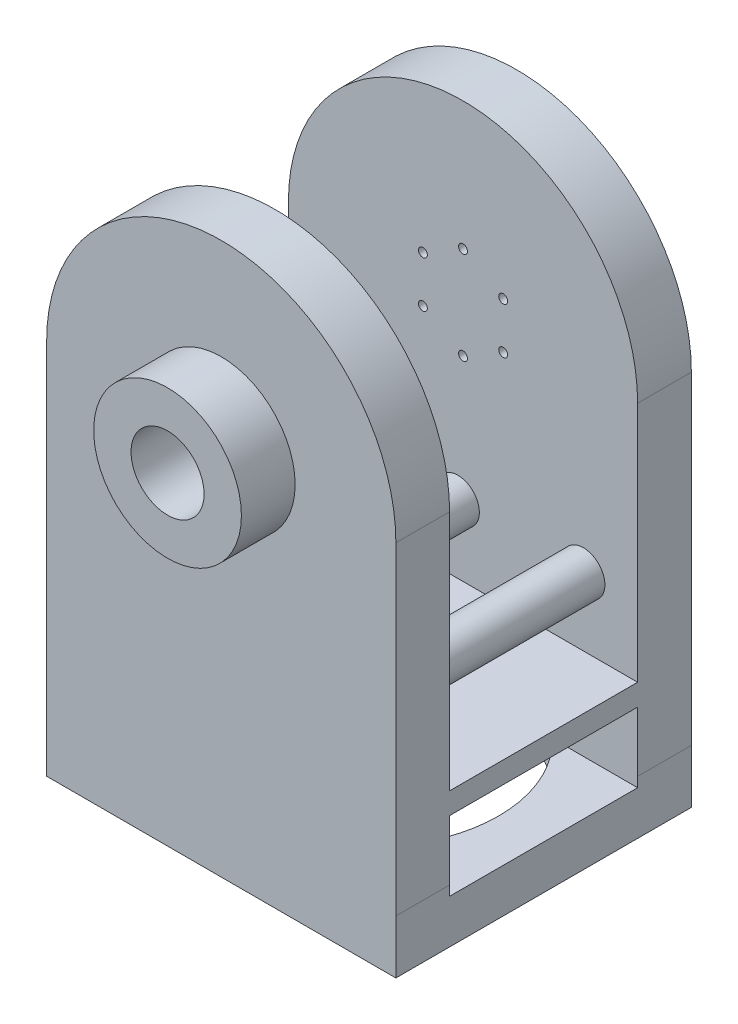
from build123d import *

# Parameters (mm, degrees)
SKETCH_1_R                      = 48.25
EXTRUDE_1_DEPTH                 = 20
SKETCH_2_R                      = 8
EXTRUDE_2_DEPTH                 = 70
EXTRUDE_START                   = 20
SKETCH_3_R                      = 48.25
EXTRUDE_3_DEPTH                 = 20
EXTRUDE_4_DEPTH                 = 149
EXTRUDE_START_2                 = -120.265870341
EXTRUDE_4_2_OUTLINE_W           = 1.999969756
EXTRUDE_4_2_OUTLINE_H           = 20
EXTRUDE_4_2_DEPTH               = 140.265870341
EXTRUDE_4_3_OUTLINE_W           = 130.000007332
EXTRUDE_4_3_OUTLINE_H           = 20
EXTRUDE_4_3_DEPTH               = 20
EXTRUDE_6_DEPTH                 = 70
CUT_EXTRUDE_3_DEPTH             = 20
EXTRUDE_START_3                 = -20
SKETCH_8_R                      = 48.25
EXTRUDE_7_DEPTH                 = 20
SKETCH_9_R                      = 48.25
EXTRUDE_8_DEPTH                 = 20
SKETCH_10_R                     = 1.65
EXTRUDE_9_DEPTH                 = 10
EXTRUDE_START_4                 = 10
SKETCH_11_R                     = 1.65
EXTRUDE_10_DEPTH                = 10
SKETCH_14_R                     = 27.5
SKETCH_14_R_2                   = 13.594481218
EXTRUDE_12_DEPTH                = 20
CUT_EXTRUDE_4_REACH             = 237.432
SKETCH_15_R                     = 1.65
CUT_EXTRUDE_4_DIRECTION_2_DEPTH = 236.431704876
EXTRUDE_13_REACH                = 227.007
SKETCH_16_W                     = 130
SKETCH_16_H                     = 8
CUT_EXTRUDE_START               = 70
SKETCH_17_R                     = 8
CUT_EXTRUDE_5_DEPTH             = 70
SKETCH_18_R                     = 1.5
EXTRUDE_14_DEPTH                = 14
CHAMFER_1_SIZE                  = 4


with BuildPart() as part:
    # 草图1 → 凸台-拉伸1 (new body)
    with BuildSketch(Plane.XY):
        with BuildLine():
            Line((-65, -103.52590801), (-65, 120.208570031))
            ThreePointArc((-65, 120.208570031), (0, 185.208570031), (65, 120.208570031))
            Line((65, 120.208570031), (65, -103.52590801))
            ThreePointArc((65, -103.52590801), (0, -168.52590801), (-65, -103.52590801))
        make_face()
        with Locations((0, 120.208570031)):
            Circle(SKETCH_1_R, mode=Mode.SUBTRACT)
        with Locations(Location((0, -103.52590801, 0), (0, 0, 180))):
            Circle(SKETCH_1_R, mode=Mode.SUBTRACT)
    extrude(amount=EXTRUDE_1_DEPTH)

    # 草图2 → 凸台-拉伸2 (add)
    with BuildSketch(Plane(origin=(0, 0, 0), x_dir=(-1, 0, 0), z_dir=(0, 0, -1))):
        with Locations(Location((-44.812568829, 55.531490167, 0), (0, 0, 180))):
            Circle(SKETCH_2_R)
        with Locations(Location((-44.812568829, -39.65707978, 0), (0, 0, 180))):
            Circle(SKETCH_2_R)
        with Locations(Location((48.660082913, -39.65707978, 0), (0, 0, 180))):
            Circle(SKETCH_2_R)
        with Locations(Location((48.660082913, 55.531490167, 0), (0, 0, 180))):
            Circle(SKETCH_2_R)
        with Locations(Location((1.923757042, 55.531490167, 0), (0, 0, 180))):
            Circle(SKETCH_2_R)
        with Locations(Location((1.923757042, -39.65707978, 0), (0, 0, 180))):
            Circle(SKETCH_2_R)
        with Locations(Location((-44.812568829, 7.937205194, 0), (0, 0, 180))):
            Circle(SKETCH_2_R)
        with Locations(Location((48.660082913, 7.937205194, 0), (0, 0, 180))):
            Circle(SKETCH_2_R)
    extrude(amount=EXTRUDE_2_DEPTH)

    # 草图3 → 凸台-拉伸3 (add)
    with BuildSketch(Plane(origin=(0, 0, -70), x_dir=(-1, 0, 0), z_dir=(0, 0, -1)).offset(EXTRUDE_START)):
        with BuildLine():
            Line((65, -103.52590801), (65, 120.208570031))
            ThreePointArc((65, 120.208570031), (0, 185.208570031), (-65, 120.208570031))
            Line((-65, 120.208570031), (-65, -103.52590801))
            ThreePointArc((-65, -103.52590801), (0, -168.52590801), (65, -103.52590801))
        make_face()
        with Locations(Location((0, 120.208570031, 0), (0, 0, 180))):
            Circle(SKETCH_3_R, mode=Mode.SUBTRACT)
        with Locations((0, -103.52590801)):
            Circle(SKETCH_3_R, mode=Mode.SUBTRACT)
    extrude(amount=-EXTRUDE_3_DEPTH)

    # 凸台-拉伸4: read off the stored shape, not the designer's step
    # 凸台-拉伸4 outline → 凸台-拉伸4 (cut)
    with BuildSketch(Plane(origin=(-2.6578e-05, -0.079137147, 0), x_dir=(0.9999999436033571, -0.0003358471121103656, 0), z_dir=(-0.0003358471121103656, -0.9999999436033572, 0)).offset(EXTRUDE_START)):
        Polygon((-64.999977088, 20), (-64.999977088, -90), (67, -90), (67, -70), (65.000030244, -70), (65.000030244, 0), (67, 0), (67, 20), align=None)
    extrude(amount=EXTRUDE_4_DEPTH, mode=Mode.SUBTRACT)

    # Extrude 4 2 outline → Extrude 4 2 (cut)
    with BuildSketch(Plane(origin=(-2.6578e-05, -0.079137147, 0), x_dir=(0.9999999436033571, -0.0003358471121103656, 0), z_dir=(-0.0003358471121103656, -0.9999999436033572, 0)).offset(EXTRUDE_START_2)):
        with Locations((66.000015122, 10)):
            Rectangle(EXTRUDE_4_2_OUTLINE_W, EXTRUDE_4_2_OUTLINE_H)
        with Locations((66.000015122, -80)):
            Rectangle(EXTRUDE_4_2_OUTLINE_W, EXTRUDE_4_2_OUTLINE_H)
    extrude(amount=EXTRUDE_4_2_DEPTH, mode=Mode.SUBTRACT)

    # Extrude 4 3 outline → Extrude 4 3 (add)
    with BuildSketch(Plane(origin=(-2.6578e-05, -0.079137147, 0), x_dir=(0.9999999436033571, -0.0003358471121103656, 0), z_dir=(-0.0003358471121103656, -0.9999999436033572, 0))):
        with Locations((2.6578e-05, 10)):
            Rectangle(EXTRUDE_4_3_OUTLINE_W, EXTRUDE_4_3_OUTLINE_H)
        with Locations((2.6578e-05, -80)):
            Rectangle(EXTRUDE_4_3_OUTLINE_W, EXTRUDE_4_3_OUTLINE_H)
    extrude(amount=EXTRUDE_4_3_DEPTH)

    # 草图6 → 凸台-拉伸6 (add)
    with BuildSketch(Plane.XY.offset(-70)):
        Polygon((64.998772091, -3.757122016), (-65.001227909, -3.713461889), (-65.006716942, -20.057305964), (64.993283058, -20.100966091), align=None)
    extrude(amount=EXTRUDE_6_DEPTH)

    # 草图7 → 切除-拉伸3 (cut)
    with BuildSketch(Plane(origin=(-0.00674352, -20.079136019, 0), x_dir=(0.9999999436033571, -0.00033584711211036565, 0), z_dir=(-0.00033584711211036565, -0.9999999436033572, 0))):
        with BuildLine():
            ThreePointArc((2.6578e-05, 13.25), (-34.117875614, -0.882097808), (-48.249973422, -35))
            Line((-48.249973422, -35), (2.6578e-05, -35))
            Line((2.6578e-05, -35), (2.6578e-05, 13.25))
        make_face()
        with BuildLine():
            Line((2.6578e-05, -35), (-48.249973422, -35))
            ThreePointArc((-48.249973422, -35), (-34.117875614, -69.117902192), (2.6578e-05, -83.25))
            Line((2.6578e-05, -83.25), (2.6578e-05, -35))
        make_face()
        with BuildLine():
            Line((2.6578e-05, 13.25), (2.6578e-05, -35))
            Line((2.6578e-05, -35), (48.250026578, -35))
            ThreePointArc((48.250026578, -35), (34.11792877, -0.882097808), (2.6578e-05, 13.25))
        make_face()
        with BuildLine():
            Line((48.250026578, -35), (2.6578e-05, -35))
            Line((2.6578e-05, -35), (2.6578e-05, -83.25))
            ThreePointArc((2.6578e-05, -83.25), (34.11792877, -69.117902192), (48.250026578, -35))
        make_face()
    extrude(amount=-CUT_EXTRUDE_3_DEPTH, mode=Mode.SUBTRACT)

    # 草图8 → 凸台-拉伸7 (add)
    with BuildSketch(Plane.XY.offset(20).offset(EXTRUDE_START_3)):
        with Locations(Location((0, 120.208570031, 0), (0, 0, 180))):
            Circle(SKETCH_8_R)
    extrude(amount=EXTRUDE_7_DEPTH)

    # 草图9 → 凸台-拉伸8 (add)
    with BuildSketch(Plane(origin=(0, 0, -90), x_dir=(-1, 0, 0), z_dir=(0, 0, -1))):
        with Locations((0, 120.208570031)):
            Circle(SKETCH_9_R)
    extrude(amount=-EXTRUDE_8_DEPTH)

    # 草图10 → 凸台-拉伸9 (add)
    with BuildSketch(Plane(origin=(0, 0, -90), x_dir=(-1, 0, 0), z_dir=(0, 0, -1))):
        with Locations((0, 137.458570031)):
            Circle(SKETCH_10_R)
        with Locations((14.938938215, 128.833570031)):
            Circle(SKETCH_10_R)
        with Locations((14.938938215, 111.583570031)):
            Circle(SKETCH_10_R)
        with Locations((0, 102.958570031)):
            Circle(SKETCH_10_R)
        with Locations((-14.938938215, 111.583570031)):
            Circle(SKETCH_10_R)
        with Locations((-14.938938215, 128.833570031)):
            Circle(SKETCH_10_R)
    extrude(amount=EXTRUDE_9_DEPTH)

    # 草图11 → 凸台-拉伸10 (add)
    with BuildSketch(Plane.XY.offset(20).offset(EXTRUDE_START_4)):
        with Locations(Location((0, 102.958570031, 0), (0, 0, 180))):
            Circle(SKETCH_11_R)
        with Locations(Location((14.938938215, 111.583570031, 0), (0, 0, 180))):
            Circle(SKETCH_11_R)
        with Locations(Location((14.938938215, 128.833570031, 0), (0, 0, 180))):
            Circle(SKETCH_11_R)
        with Locations(Location((0, 137.458570031, 0), (0, 0, 180))):
            Circle(SKETCH_11_R)
        with Locations(Location((-14.938938215, 128.833570031, 0), (0, 0, 180))):
            Circle(SKETCH_11_R)
        with Locations(Location((-14.938938215, 111.583570031, 0), (0, 0, 180))):
            Circle(SKETCH_11_R)
    extrude(amount=-EXTRUDE_10_DEPTH)

    # 草图14 → 凸台-拉伸12 (add)
    with BuildSketch(Plane.XY.offset(20)):
        with Locations((0, 120.208570031)):
            Circle(SKETCH_14_R)
        with Locations((0, 120.208570031)):
            Circle(SKETCH_14_R_2, mode=Mode.SUBTRACT)
    extrude(amount=EXTRUDE_12_DEPTH)

    # 草图15 → 切除-拉伸4 (cut, up to next)
    with BuildSketch(Plane(origin=(0, 0, -90), x_dir=(-1, 0, 0), z_dir=(0, 0, -1)), mode=Mode.PRIVATE) as cut_extrude_4_sk1:
        with Locations((0, 102.958570031)):
            Circle(SKETCH_15_R)
    cut_extrude_4_tool1 = extrude(cut_extrude_4_sk1.sketch, amount=-CUT_EXTRUDE_4_REACH, mode=Mode.PRIVATE) & part.part
    # 草图15 → 切除-拉伸4 (cut, up to next)
    with BuildSketch(Plane(origin=(0, 0, -90), x_dir=(-1, 0, 0), z_dir=(0, 0, -1)), mode=Mode.PRIVATE) as cut_extrude_4_sk2:
        with Locations((-14.938938215, 111.583570031)):
            Circle(SKETCH_15_R)
    cut_extrude_4_tool2 = extrude(cut_extrude_4_sk2.sketch, amount=-CUT_EXTRUDE_4_REACH, mode=Mode.PRIVATE) & part.part
    # 草图15 → 切除-拉伸4 (cut, up to next)
    with BuildSketch(Plane(origin=(0, 0, -90), x_dir=(-1, 0, 0), z_dir=(0, 0, -1)), mode=Mode.PRIVATE) as cut_extrude_4_sk3:
        with Locations((-14.938938215, 128.833570031)):
            Circle(SKETCH_15_R)
    cut_extrude_4_tool3 = extrude(cut_extrude_4_sk3.sketch, amount=-CUT_EXTRUDE_4_REACH, mode=Mode.PRIVATE) & part.part
    # 草图15 → 切除-拉伸4 (cut, up to next)
    with BuildSketch(Plane(origin=(0, 0, -90), x_dir=(-1, 0, 0), z_dir=(0, 0, -1)), mode=Mode.PRIVATE) as cut_extrude_4_sk4:
        with Locations((0, 137.458570031)):
            Circle(SKETCH_15_R)
    cut_extrude_4_tool4 = extrude(cut_extrude_4_sk4.sketch, amount=-CUT_EXTRUDE_4_REACH, mode=Mode.PRIVATE) & part.part
    # 草图15 → 切除-拉伸4 (cut, up to next)
    with BuildSketch(Plane(origin=(0, 0, -90), x_dir=(-1, 0, 0), z_dir=(0, 0, -1)), mode=Mode.PRIVATE) as cut_extrude_4_sk5:
        with Locations((14.938938215, 128.833570031)):
            Circle(SKETCH_15_R)
    cut_extrude_4_tool5 = extrude(cut_extrude_4_sk5.sketch, amount=-CUT_EXTRUDE_4_REACH, mode=Mode.PRIVATE) & part.part
    # 草图15 → 切除-拉伸4 (cut, up to next)
    with BuildSketch(Plane(origin=(0, 0, -90), x_dir=(-1, 0, 0), z_dir=(0, 0, -1)), mode=Mode.PRIVATE) as cut_extrude_4_sk6:
        with Locations((14.938938215, 111.583570031)):
            Circle(SKETCH_15_R)
    cut_extrude_4_tool6 = extrude(cut_extrude_4_sk6.sketch, amount=-CUT_EXTRUDE_4_REACH, mode=Mode.PRIVATE) & part.part
    add(cut_extrude_4_tool1.solids().sort_by_distance((0, 102.95857, -90))[0], mode=Mode.SUBTRACT)
    add(cut_extrude_4_tool2.solids().sort_by_distance((14.938938, 111.58357, -90))[0], mode=Mode.SUBTRACT)
    add(cut_extrude_4_tool3.solids().sort_by_distance((14.938938, 128.83357, -90))[0], mode=Mode.SUBTRACT)
    add(cut_extrude_4_tool4.solids().sort_by_distance((0, 137.45857, -90))[0], mode=Mode.SUBTRACT)
    add(cut_extrude_4_tool5.solids().sort_by_distance((-14.938938, 128.83357, -90))[0], mode=Mode.SUBTRACT)
    add(cut_extrude_4_tool6.solids().sort_by_distance((-14.938938, 111.58357, -90))[0], mode=Mode.SUBTRACT)

    # 草图15 → 切除-拉伸4 direction 2 (cut)
    with BuildSketch(Plane(origin=(0, 0, -90), x_dir=(-1, 0, 0), z_dir=(0, 0, -1))):
        with Locations((0, 102.958570031)):
            Circle(SKETCH_15_R)
        with Locations((-14.938938215, 111.583570031)):
            Circle(SKETCH_15_R)
        with Locations((-14.938938215, 128.833570031)):
            Circle(SKETCH_15_R)
        with Locations((0, 137.458570031)):
            Circle(SKETCH_15_R)
        with Locations((14.938938215, 128.833570031)):
            Circle(SKETCH_15_R)
        with Locations((14.938938215, 111.583570031)):
            Circle(SKETCH_15_R)
    extrude(amount=CUT_EXTRUDE_4_DIRECTION_2_DEPTH, mode=Mode.SUBTRACT)

    # 草图16 → 凸台-拉伸13 (add, up to next)
    with BuildSketch(Plane.XY.offset(-70), mode=Mode.PRIVATE) as extrude_13_sk1:
        with Locations((0, 26.242694036)):
            Rectangle(SKETCH_16_W, SKETCH_16_H)
    extrude_13_tool1 = extrude(extrude_13_sk1.sketch, amount=EXTRUDE_13_REACH, mode=Mode.PRIVATE) - part.part
    add(extrude_13_tool1.solids().sort_by_distance((0, 26.242694, -70))[0])

    # 草图17 → 切除-拉伸5 (cut)
    with BuildSketch(Plane.XY.offset(-70).offset(CUT_EXTRUDE_START)):
        with Locations((44.812568829, 7.937205194)):
            Circle(SKETCH_17_R)
        with Locations((-48.660082913, 7.937205194)):
            Circle(SKETCH_17_R)
    extrude(amount=-CUT_EXTRUDE_5_DEPTH, mode=Mode.SUBTRACT)

    # 草图18 → 凸台-拉伸14 (add)
    with BuildSketch(Plane.XZ.offset(-22.242694036)):
        with Locations((-0.006716942, 7.5)):
            Circle(SKETCH_18_R)
        with Locations(Location((36.799362719, -13.75, 0), (0, 0, 90))):
            Circle(SKETCH_18_R)
        with Locations(Location((36.799362719, -56.25, 0), (0, 0, 90))):
            Circle(SKETCH_18_R)
        with Locations((-0.006716942, -77.5)):
            Circle(SKETCH_18_R)
        with Locations(Location((-36.812796603, -56.25, 0), (0, 0, 90))):
            Circle(SKETCH_18_R)
        with Locations(Location((-36.812796603, -13.75, 0), (0, 0, 90))):
            Circle(SKETCH_18_R)
    extrude(amount=EXTRUDE_14_DEPTH)

    # 倒角1
    chamfer_1_edges = [part.edges().sort_by_distance(p)[0] for p in [
        (36.799362719, 22.242694036, -15.25),
        (36.799362719, 22.242694036, -57.75),
        (-36.812796603, 22.242694036, -57.75),
        (-36.812796603, 22.242694036, -15.25),
    ]]
    chamfer(chamfer_1_edges, length=CHAMFER_1_SIZE)


solid = part.part
